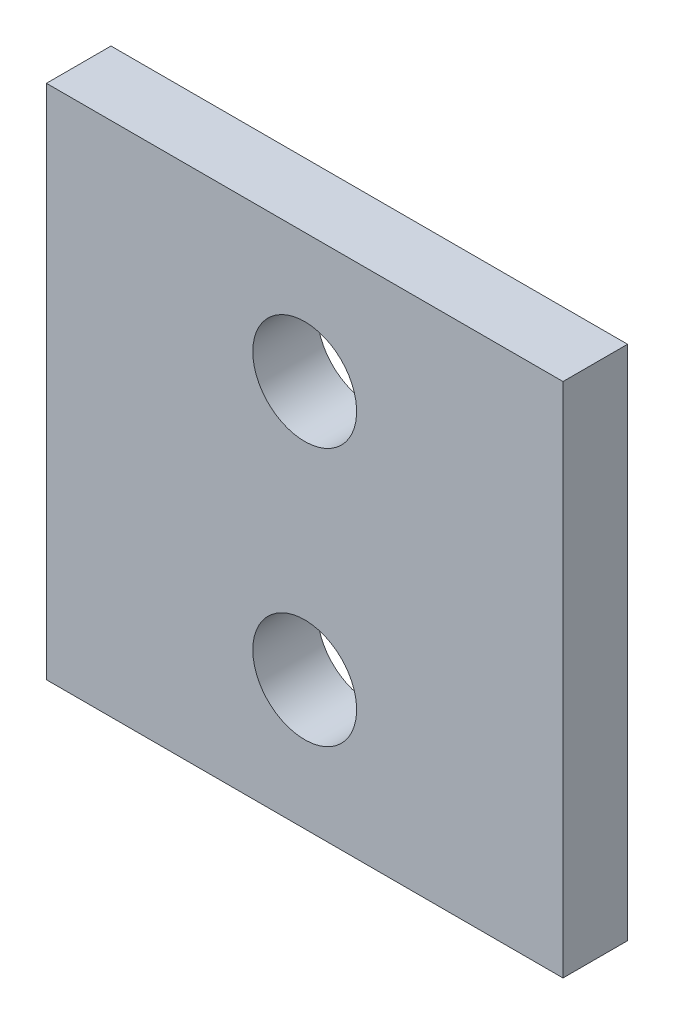
from build123d import *

# Parameters (mm, degrees)
SKETCH1_W           = 25.4
SKETCH1_H           = 25.4
BOSS_EXTRUDE1_DEPTH = 3.175
CUT_EXTRUDE1_REACH  = 38.061
SKETCH2_R           = 2.5527


with BuildPart() as part:
    # Sketch1 → Boss-Extrude1 (new body)
    with BuildSketch(Plane.XY):
        with Locations((12.7, 12.7)):
            Rectangle(SKETCH1_W, SKETCH1_H)
    extrude(amount=BOSS_EXTRUDE1_DEPTH)

    # Sketch2 → Cut-Extrude1 (cut, up to next)
    with BuildSketch(Plane(origin=(0, 0, 0), x_dir=(-1, 0, 0), z_dir=(0, 0, -1)), mode=Mode.PRIVATE) as cut_extrude1_sk1:
        with Locations((-12.7, 6.35)):
            Circle(SKETCH2_R)
    cut_extrude1_tool1 = extrude(cut_extrude1_sk1.sketch, amount=-CUT_EXTRUDE1_REACH, mode=Mode.PRIVATE) & part.part
    # Sketch2 → Cut-Extrude1 (cut, up to next)
    with BuildSketch(Plane(origin=(0, 0, 0), x_dir=(-1, 0, 0), z_dir=(0, 0, -1)), mode=Mode.PRIVATE) as cut_extrude1_sk2:
        with Locations((-12.7, 19.05)):
            Circle(SKETCH2_R)
    cut_extrude1_tool2 = extrude(cut_extrude1_sk2.sketch, amount=-CUT_EXTRUDE1_REACH, mode=Mode.PRIVATE) & part.part
    add(cut_extrude1_tool1.solids().sort_by_distance((12.7, 6.35, 0))[0], mode=Mode.SUBTRACT)
    add(cut_extrude1_tool2.solids().sort_by_distance((12.7, 19.05, 0))[0], mode=Mode.SUBTRACT)


solid = part.part
